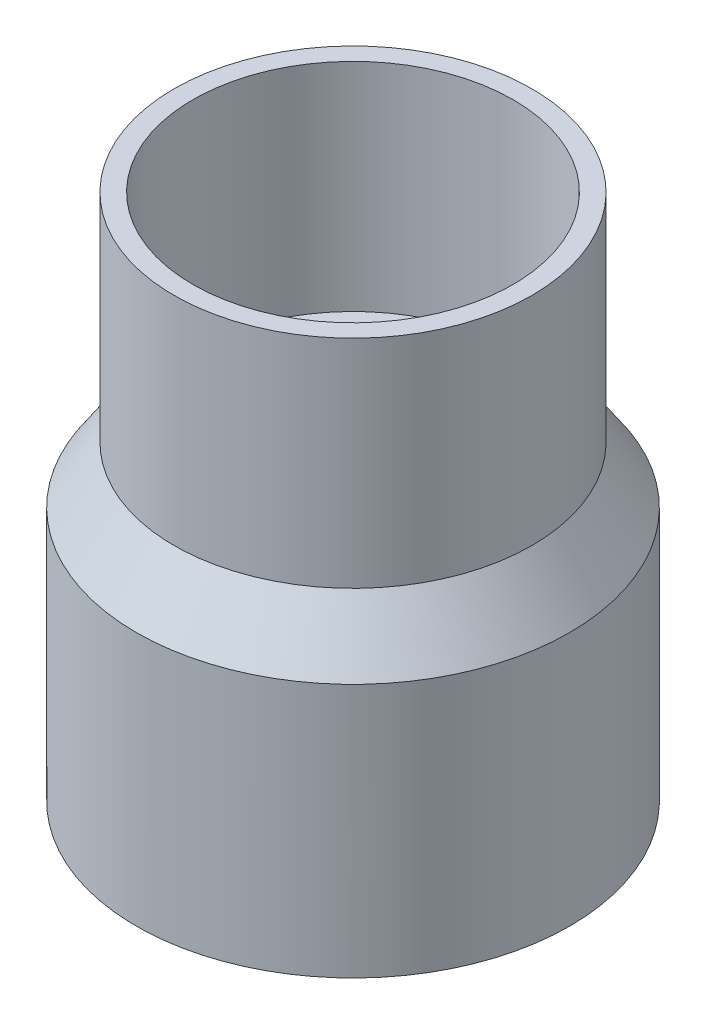
from build123d import *

# Parameters (mm, degrees)
SKETCH1_R           = 23
SKETCH1_R_2         = 21
EXTRUDE_THIN1_DEPTH = 27
SKETCH2_R           = 19
SKETCH2_R_2         = 17
EXTRUDE_THIN2_DEPTH = 23
SKETCH3_R           = 21
BOSS_EXTRUDE1_DEPTH = 6
BOSS_EXTRUDE1_TAPER = 34
SKETCH4_R           = 23
BOSS_EXTRUDE2_DEPTH = 6
BOSS_EXTRUDE2_TAPER = 34


with BuildPart() as part:
    # Sketch1 → Extrude-Thin1 (new body)
    with BuildSketch(Plane(origin=(0, 0, 0), x_dir=(1, 0, 0), z_dir=(0, 1, 0))):
        Circle(SKETCH1_R)
        Circle(SKETCH1_R_2, mode=Mode.SUBTRACT)
    extrude(amount=EXTRUDE_THIN1_DEPTH)



with BuildPart() as body_2:
    # Sketch2 → Extrude-Thin2 (new body)
    with BuildSketch(Plane(origin=(0, 0, 0), x_dir=(1, 0, 0), z_dir=(0, 1, 0))):
        Circle(SKETCH2_R)
        Circle(SKETCH2_R_2, mode=Mode.SUBTRACT)
    extrude(amount=EXTRUDE_THIN2_DEPTH)


with BuildPart() as body_2_1:
    # Move Face1: read off the stored shape, not the designer's step
    # Move Face1: moved
    add(body_2.part.moved(Location((0, 33, 0))))


with BuildPart() as body_3:
    # Sketch3 → Boss-Extrude1 (new body)
    with BuildSketch(Plane(origin=(0, 27, 0), x_dir=(1, 0, 0), z_dir=(0, 1, 0))):
        with Locations(Location((0, 0, 0), (0, 0, 270))):
            Circle(SKETCH3_R)
    extrude(amount=BOSS_EXTRUDE1_DEPTH, taper=BOSS_EXTRUDE1_TAPER)


with BuildPart() as part_1:
    add(part.part)

    add(body_2_1.part)  # Boss-Extrude2 merges body 2

    add(body_3.part)  # Boss-Extrude2 merges body 3
    # Sketch4 → Boss-Extrude2 (add)
    with BuildSketch(Plane(origin=(0, 27, 0), x_dir=(1, 0, 0), z_dir=(0, 1, 0))):
        Circle(SKETCH4_R)
    extrude(amount=BOSS_EXTRUDE2_DEPTH, taper=BOSS_EXTRUDE2_TAPER)


solid = part_1.part
